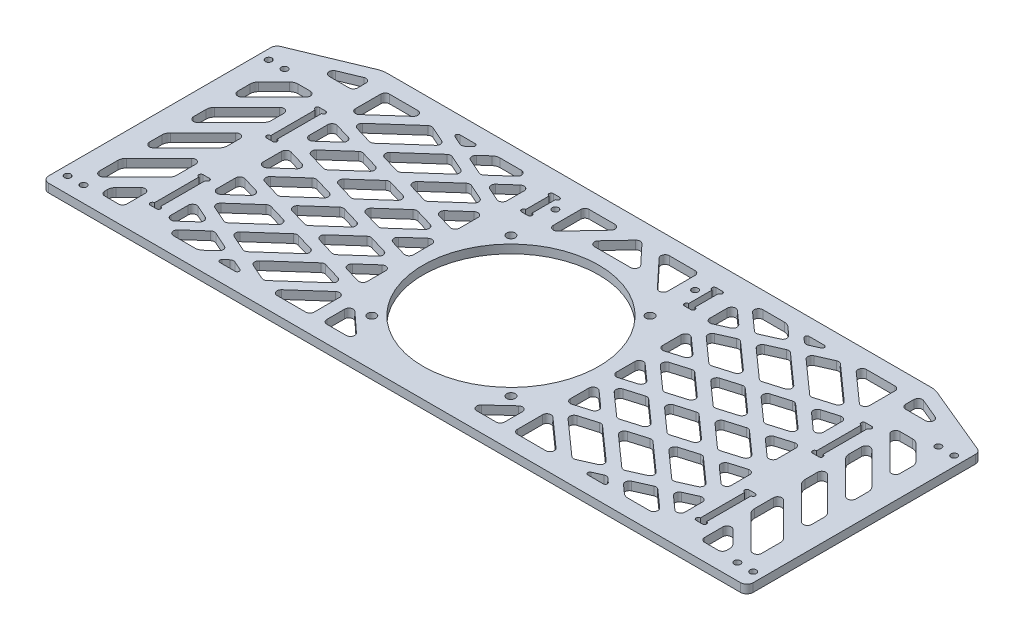
from build123d import *

# Parameters (mm, degrees)
SKETCH_1_R          = 41.5
SKETCH_1_R_2        = 1.5
SKETCH_1_W          = 3
SKETCH_1_H          = 25
EXTRUDE_1_DEPTH     = 4
SKETCH_2_R          = 2
SKETCH_2_W          = 3
SKETCH_2_H          = 15
CUT_EXTRUDE_1_DEPTH = 181.660593379
SKETCH_3_R          = 1
CUT_EXTRUDE_2_DEPTH = 181.660593379
SKETCH_12_W         = 73.5
SKETCH_12_H         = 109
CUT_EXTRUDE_8_DEPTH = 181.660593379
EXTRUDE_1_2_DEPTH   = 4
EXTRUDE_2_DEPTH     = 4
FILLET_1_R          = 3
FILLET_2_R          = 10
FILLET_3_R          = 4
FILLET_4_R          = 1
FILLET_5_R          = 2


with BuildPart() as part:
    # 草图1 → Extrude 1 (new body)
    with BuildSketch(Plane(origin=(0, 0, 0), x_dir=(1, 0, 0), z_dir=(0, 1, 0))):
        Polygon((-166.5, -55), (166.5, -55), (166.5, 55), (130.5, 70), (-130.5, 70), (-166.5, 55), align=None)
        with Locations(Location((0, 0, 0), (0, 0, 270))):
            Circle(SKETCH_1_R, mode=Mode.SUBTRACT)
        with Locations(Location((-33, 54, 0), (0, 0, 270))):
            Circle(SKETCH_1_R_2, mode=Mode.SUBTRACT)
        with Locations(Location((33, 54, 0), (0, 0, 270))):
            Circle(SKETCH_1_R_2, mode=Mode.SUBTRACT)
        with Locations(Location((-162, 47.5, 0), (0, 0, 270))):
            Circle(SKETCH_1_R_2, mode=Mode.SUBTRACT)
        with Locations(Location((-154.5, 47.5, 0), (0, 0, 270))):
            Circle(SKETCH_1_R_2, mode=Mode.SUBTRACT)
        with Locations(Location((-154.5, -47.5, 0), (0, 0, 270))):
            Circle(SKETCH_1_R_2, mode=Mode.SUBTRACT)
        with Locations(Location((-162, -47.5, 0), (0, 0, 270))):
            Circle(SKETCH_1_R_2, mode=Mode.SUBTRACT)
        with Locations(Location((154.5, -47.5, 0), (0, 0, 90))):
            Circle(SKETCH_1_R_2, mode=Mode.SUBTRACT)
        with Locations(Location((162, -47.5, 0), (0, 0, 90))):
            Circle(SKETCH_1_R_2, mode=Mode.SUBTRACT)
        with Locations(Location((154.5, 47.5, 0), (0, 0, 90))):
            Circle(SKETCH_1_R_2, mode=Mode.SUBTRACT)
        with Locations(Location((162, 47.5, 0), (0, 0, 90))):
            Circle(SKETCH_1_R_2, mode=Mode.SUBTRACT)
        with Locations((-129, 27.5)):
            Rectangle(SKETCH_1_W, SKETCH_1_H, mode=Mode.SUBTRACT)
        with Locations((129, -27.5)):
            Rectangle(SKETCH_1_W, SKETCH_1_H, mode=Mode.SUBTRACT)
        with Locations((129, 27.5)):
            Rectangle(SKETCH_1_W, SKETCH_1_H, mode=Mode.SUBTRACT)
        with Locations((-129, -27.5)):
            Rectangle(SKETCH_1_W, SKETCH_1_H, mode=Mode.SUBTRACT)
    extrude(amount=EXTRUDE_1_DEPTH)

    # 草图2 → 切除-拉伸1 (cut, through all)
    with BuildSketch(Plane(origin=(0, 4, 0), x_dir=(1, 0, 0), z_dir=(0, 1, 0))):
        with Locations(Location((-32.880465325, 32.880465325, 0), (0, 0, 270))):
            Circle(SKETCH_2_R)
        with Locations(Location((32.880465325, 32.880465325, 0), (0, 0, 90))):
            Circle(SKETCH_2_R)
        with Locations(Location((32.880465325, -32.880465325, 0), (0, 0, 270))):
            Circle(SKETCH_2_R)
        with Locations(Location((-32.880465325, -32.880465325, 0), (0, 0, 90))):
            Circle(SKETCH_2_R)
        with Locations((38.5, 52.5)):
            Rectangle(SKETCH_2_W, SKETCH_2_H)
        with Locations((-38.5, 52.5)):
            Rectangle(SKETCH_2_W, SKETCH_2_H)
    extrude(amount=-CUT_EXTRUDE_1_DEPTH, mode=Mode.SUBTRACT)

    # 草图3 → 切除-拉伸2 (cut, through all)
    with BuildSketch(Plane(origin=(0, 4, 0), x_dir=(1, 0, 0), z_dir=(0, 1, 0))):
        with Locations((-40, 59)):
            Circle(SKETCH_3_R)
        with Locations((-37, 59)):
            Circle(SKETCH_3_R)
        with Locations((-37, 46)):
            Circle(SKETCH_3_R)
        with Locations((-40, 46)):
            Circle(SKETCH_3_R)
        with Locations((40, 46)):
            Circle(SKETCH_3_R)
        with Locations((37, 46)):
            Circle(SKETCH_3_R)
        with Locations((37, 59)):
            Circle(SKETCH_3_R)
        with Locations((40, 59)):
            Circle(SKETCH_3_R)
        with Locations((-130.5, 39)):
            Circle(SKETCH_3_R)
        with Locations((-127.5, 39)):
            Circle(SKETCH_3_R)
        with Locations((-127.5, 16)):
            Circle(SKETCH_3_R)
        with Locations((-130.5, 16)):
            Circle(SKETCH_3_R)
        with Locations((-130.5, -16)):
            Circle(SKETCH_3_R)
        with Locations((-127.5, -16)):
            Circle(SKETCH_3_R)
        with Locations((-127.5, -39)):
            Circle(SKETCH_3_R)
        with Locations((-130.5, -39)):
            Circle(SKETCH_3_R)
        with Locations((130.5, -39)):
            Circle(SKETCH_3_R)
        with Locations((127.5, -39)):
            Circle(SKETCH_3_R)
        with Locations((127.5, -16)):
            Circle(SKETCH_3_R)
        with Locations((130.5, -16)):
            Circle(SKETCH_3_R)
        with Locations((130.5, 16)):
            Circle(SKETCH_3_R)
        with Locations((127.5, 16)):
            Circle(SKETCH_3_R)
        with Locations((127.5, 39)):
            Circle(SKETCH_3_R)
        with Locations((130.5, 39)):
            Circle(SKETCH_3_R)
    extrude(amount=-CUT_EXTRUDE_2_DEPTH, mode=Mode.SUBTRACT)

    # 草图12 → 切除-拉伸8 (cut, through all)
    with BuildSketch(Plane(origin=(0, 4, 0), x_dir=(1, 0, 0), z_dir=(0, 1, 0))):
        Polygon((-136.5, -7.64061146), (-136.5, -23.077665043), (-153.422334957, -40), (-156.5, -40), (-156.5, -27.64061146), align=None)
        Polygon((-136.5, 13.204058454), (-136.5, 0.844669914), (-156.5, -19.155330086), (-156.5, -6.795941546), align=None)
        Polygon((-156.5, 14.048728368), (-156.5, 1.689339828), (-136.5, 21.689339828), (-136.5, 34.048728368), align=None)
        Polygon((-136.5, -31.562946417), (-147, -42.062946417), (-147, -47), (-136.5, -47), align=None)
        Polygon((-146.85938854, 44.534009742), (-156.5, 34.893398282), (-156.5, 22.534009742), (-134.5, 44.534009742), align=None)
        Polygon((-129.5, 63.916666667), (-150.9, 55), (-129.5, 55), align=None)
        Polygon((-42, -32), (-25.74475114, -47), (-42, -47), align=None)
        with Locations((-84.75, 7.5)):
            Rectangle(SKETCH_12_W, SKETCH_12_H)
        Polygon((134.5, 44.534009742), (156.5, 22.534009742), (156.5, 34.893398282), (146.85938854, 44.534009742), align=None)
        Polygon((136.5, 34.048728368), (156.5, 14.048728368), (156.5, 1.689339828), (136.5, 21.689339828), align=None)
        Polygon((136.5, -23.077665043), (153.422334957, -40), (156.5, -40), (156.5, -27.64061146), (136.5, -7.64061146), align=None)
        Polygon((136.5, 0.844669914), (156.5, -19.155330086), (156.5, -6.795941546), (136.5, 13.204058454), align=None)
        with Locations((84.75, 7.5)):
            Rectangle(SKETCH_12_W, SKETCH_12_H)
        Polygon((42, -47), (42, -32), (25.74475114, -47), align=None)
        Polygon((129.5, 55), (129.5, 63.916666667), (150.9, 55), align=None)
        Polygon((147, -42.062946417), (147, -47), (136.5, -47), (136.5, -31.562946417), align=None)
        Polygon((-27, 62), (-27, 42), (-8.228752915, 62), align=None)
        Polygon((0, 62), (-13.139872959, 48), (13.139872959, 48), align=None)
        Polygon((8.228752915, 62), (27, 62), (27, 42), align=None)
    extrude(amount=-CUT_EXTRUDE_8_DEPTH, mode=Mode.SUBTRACT)

    # 草图13 → Extrude 1 2 (add)
    with BuildSketch(Plane(origin=(0, 4, 0), x_dir=(1, 0, 0), z_dir=(0, 1, 0))):
        Polygon((-71.920637458, 65.861908731), (-74.161855711, 63.867681877), (-126.518600414, 17.280864142), (-53.018600414, -4.519135858), (-98.661855711, -45.132318123), (-100.903073964, -47.126544976), (-97.579362542, -50.861908731), (-95.338144289, -48.867681877), (-42.981399586, -2.280864142), (-116.481399586, 19.519135858), (-70.838144289, 60.132318123), (-68.596926036, 62.126544976), align=None)
        Polygon((-49.661855711, 63.867681877), (-126.518600414, -4.519135858), (-48.710886968, -27.596797805), (-47.289113032, -22.803202195), (-116.481399586, -2.280864142), (-46.338144289, 60.132318123), align=None)
        Polygon((-119.838144289, -48.867681877), (-42.981399586, 19.519135858), (-120.789113032, 42.596797805), (-122.210886968, 37.803202195), (-53.018600414, 17.280864142), (-123.161855711, -45.132318123), align=None)
        Polygon((-71.483788884, -44.715855747), (-116.942663735, -24.491295099), (-43.442663735, 40.908704901), (-95.983788884, 64.284144253), (-98.016211116, 59.715855747), (-52.557336265, 39.491295099), (-126.057336265, -25.908704901), (-73.516211116, -49.284144253), align=None)
        Polygon((68.596926036, 62.126544976), (70.838144289, 60.132318123), (116.481399586, 19.519135858), (42.981399586, -2.280864142), (95.338144289, -48.867681877), (97.579362542, -50.861908731), (100.903073964, -47.126544976), (98.661855711, -45.132318123), (53.018600414, -4.519135858), (126.518600414, 17.280864142), (74.161855711, 63.867681877), (71.920637458, 65.861908731), align=None)
        Polygon((95.983788884, 64.284144253), (43.442663735, 40.908704901), (116.942663735, -24.491295099), (71.483788884, -44.715855747), (73.516211116, -49.284144253), (126.057336265, -25.908704901), (52.557336265, 39.491295099), (98.016211116, 59.715855747), align=None)
        Polygon((46.338144289, 60.132318123), (116.481399586, -2.280864142), (47.289113032, -22.803202195), (48.710886968, -27.596797805), (126.518600414, -4.519135858), (49.661855711, 63.867681877), align=None)
        Polygon((120.789113032, 42.596797805), (42.981399586, 19.519135858), (119.838144289, -48.867681877), (123.161855711, -45.132318123), (53.018600414, 17.280864142), (122.210886968, 37.803202195), align=None)
    extrude(amount=-EXTRUDE_1_2_DEPTH)

    # 草图14 → 拉伸-薄壁2 (add)
    with BuildSketch(Plane(origin=(0, 4, 0), x_dir=(1, 0, 0), z_dir=(0, 1, 0))):
        Polygon((95.338144289, 60.132318123), (119.838144289, 38.332318123), (123.161855711, 42.067681877), (98.661855711, 63.867681877), align=None)
        Polygon((74.161855711, -45.132318123), (49.661855711, -23.332318123), (46.338144289, -27.067681877), (70.838144289, -48.867681877), align=None)
        Polygon((-70.838144289, -48.867681877), (-46.338144289, -27.067681877), (-49.661855711, -23.332318123), (-74.161855711, -45.132318123), align=None)
        Polygon((-98.661855711, 63.867681877), (-123.161855711, 42.067681877), (-119.838144289, 38.332318123), (-95.338144289, 60.132318123), align=None)
    extrude(amount=-EXTRUDE_2_DEPTH)

    # 圆角1
    fillet_1_edges = [part.edges().sort_by_distance(p)[0] for p in [
        (166.5, 2, 55),
        (-166.5, 2, 55),
        (-166.5, 2, -55),
        (166.5, 2, -55),
    ]]
    fillet(fillet_1_edges, radius=FILLET_1_R)

    # 圆角2
    fillet_2_edges = [part.edges().sort_by_distance(p)[0] for p in [
        (-130.5, 2, -70),
        (130.5, 2, -70),
    ]]
    fillet(fillet_2_edges, radius=FILLET_2_R)

    # 圆角3
    fillet_3_edges = [part.edges().sort_by_distance(p)[0] for p in [
        (-136.5, 2, -21.689339828),
        (-156.5, 2, -14.048728368),
        (-156.5, 2, 6.795941546),
        (-136.5, 2, -0.844669914),
        (-156.5, 2, 27.64061146),
        (-136.5, 2, 23.077665043),
        (147, 2, 42.062946417),
        (136.5, 2, -21.689339828),
        (156.5, 2, -14.048728368),
        (146.85938854, 2, -44.534009742),
        (156.5, 2, -34.893398282),
        (136.5, 2, -0.844669914),
        (156.5, 2, 6.795941546),
        (136.5, 2, 23.077665043),
        (156.5, 2, 27.64061146),
        (-146.85938854, 2, -44.534009742),
        (-156.5, 2, -34.893398282),
        (-147, 2, 42.062946417),
        (-100.760855986, 2, 47),
        (-68.739144014, 2, -62),
        (100.760855986, 2, 47),
        (68.739144014, 2, -62),
    ]]
    fillet(fillet_3_edges, radius=FILLET_3_R)

    # 圆角4
    fillet_4_edges = [part.edges().sort_by_distance(p)[0] for p in [
        (-93.239144014, 2, 47),
        (-78.650296822, 2, 47),
        (-76.260855986, 2, -62),
        (-90.849703178, 2, -62),
        (93.239144014, 2, 47),
        (78.650296822, 2, 47),
        (76.260855986, 2, -62),
        (90.849703178, 2, -62),
    ]]
    fillet(fillet_4_edges, radius=FILLET_4_R)

    # 圆角5
    fillet_5_edges = [part.edges().sort_by_distance(p)[0] for p in [
        (64.790471717, 2, -50.406301105),
        (76.109330402, 2, -55.442038234),
        (63.87619495, 2, -44.527032228),
        (96.542861616, 2, -59.060365562),
        (100.760855986, 2, -62),
        (121.5, 2, -43.546394306),
        (116.481399586, 2, -41.319135858),
        (72.957138384, 2, 44.060365562),
        (68.739144014, 2, 47),
        (48, 2, 28.546394306),
        (53.018600414, 2, 26.319135858),
        (-53.018600414, 2, 26.319135858),
        (-48, 2, 28.546394306),
        (-72.957138384, 2, 44.060365562),
        (-68.739144014, 2, 47),
        (-116.481399586, 2, -41.319135858),
        (-121.5, 2, -43.546394306),
        (-96.542861616, 2, -59.060365562),
        (-100.760855986, 2, -62),
        (-136.5, 2, -34.048728368),
        (-156.5, 2, -1.689339828),
        (13.139872959, 2, -48),
        (-13.139872959, 2, -48),
        (0, 2, -62),
        (-136.5, 2, -13.204058454),
        (-156.5, 2, 19.155330086),
        (-153.422334957, 2, 40),
        (-156.5, 2, 40),
        (-136.5, 2, 7.64061146),
        (136.5, 2, 31.562946417),
        (147, 2, 47),
        (136.5, 2, 47),
        (150.9, 2, -55),
        (129.5, 2, -55),
        (129.5, 2, -63.916666667),
        (42, 2, 47),
        (25.74475114, 2, 47),
        (42, 2, 32),
        (121.5, 2, -62),
        (48, 2, 47),
        (136.5, 2, -34.048728368),
        (156.5, 2, -1.689339828),
        (134.5, 2, -44.534009742),
        (156.5, 2, -22.534009742),
        (136.5, 2, -13.204058454),
        (156.5, 2, 19.155330086),
        (136.5, 2, 7.64061146),
        (156.5, 2, 40),
        (153.422334957, 2, 40),
        (-129.5, 2, -63.916666667),
        (-129.5, 2, -55),
        (-150.9, 2, -55),
        (-42, 2, 47),
        (-42, 2, 32),
        (-25.74475114, 2, 47),
        (-121.5, 2, -62),
        (-48, 2, 47),
        (-27, 2, -62),
        (-8.228752915, 2, -62),
        (-27, 2, -42),
        (-134.5, 2, -44.534009742),
        (-156.5, 2, -22.534009742),
        (27, 2, -42),
        (8.228752915, 2, -62),
        (27, 2, -62),
        (-147, 2, 47),
        (-136.5, 2, 31.562946417),
        (-136.5, 2, 47),
        (-117.739144014, 2, 47),
        (-48, 2, 0.792354087),
        (-48, 2, 6.746394306),
        (-48, 2, 22.592354087),
        (-48, 2, -15.053605694),
        (-48, 2, -21.007645913),
        (-48, 2, -58.653605694),
        (-48, 2, -42.936254504),
        (-48, 2, -36.853605694),
        (-51.760855986, 2, -62),
        (-121.5, 2, 6.007645913),
        (-121.5, 2, 0.053605694),
        (-121.5, 2, -15.792354087),
        (-121.5, 2, -21.746394306),
        (-121.5, 2, -37.592354087),
        (-121.5, 2, 43.653605694),
        (-121.5, 2, 27.936254504),
        (-121.5, 2, 21.853605694),
        (-108.143600414, 2, 9.969135858),
        (-109.724002931, 2, 33.175371568),
        (-108.143600414, 2, -33.630864142),
        (-108.143600414, 2, -11.830864142),
        (-64.790471717, 2, -50.406301105),
        (-81.12380505, 2, -57.672967772),
        (-61.356399586, 2, -24.969135858),
        (-59.775997069, 2, -48.175371568),
        (-61.356399586, 2, 18.630864142),
        (-61.356399586, 2, -3.169135858),
        (-88.37619495, 2, 42.672967772),
        (-104.709528283, 2, 35.406301105),
        (-116.942663735, 2, 24.491295099),
        (-100.609330402, 2, 31.757961766),
        (-79.731399586, 2, -8.619135858),
        (-98.106399586, 2, 7.730864142),
        (-76.109330402, 2, -55.442038234),
        (-85.224002931, 2, -54.024628432),
        (-68.890669598, 2, -46.757961766),
        (-71.393600414, 2, -22.730864142),
        (-89.768600414, 2, -6.380864142),
        (-93.390669598, 2, 40.442038234),
        (-84.275997069, 2, 39.024628432),
        (-52.557336265, 2, -39.491295099),
        (-89.768600414, 2, -28.180864142),
        (-103.747683566, 2, -15.742333011),
        (-116.481399586, 2, -19.519135858),
        (-102.502316434, 2, -31.957666989),
        (-85.372683566, 2, -32.092333011),
        (-103.747683566, 2, -37.542333011),
        (-102.502316434, 2, -10.157666989),
        (-103.747683566, 2, 6.057666989),
        (-116.481399586, 2, 2.280864142),
        (-85.372683566, 2, -10.292333011),
        (-98.106399586, 2, -14.069135858),
        (-66.997683566, 2, -26.642333011),
        (-84.127316434, 2, -26.507666989),
        (-63.87619495, 2, -44.527032228),
        (-79.731399586, 2, -30.419135858),
        (-80.209528283, 2, -51.793698895),
        (-98.106399586, 2, -35.869135858),
        (-105.62380505, 2, 29.527032228),
        (-84.127316434, 2, 17.092333011),
        (-65.752316434, 2, -21.057666989),
        (-53.018600414, 2, -17.280864142),
        (-89.290471717, 2, 36.793698895),
        (-71.393600414, 2, 20.869135858),
        (-102.502316434, 2, 11.642333011),
        (-89.768600414, 2, 15.419135858),
        (-84.127316434, 2, -4.707666989),
        (-71.393600414, 2, -0.930864142),
        (-85.372683566, 2, 11.507666989),
        (-65.752316434, 2, 0.742333011),
        (-66.997683566, 2, -4.842333011),
        (-65.752316434, 2, 22.542333011),
        (-53.018600414, 2, 4.519135858),
        (-79.731399586, 2, 13.180864142),
        (-66.997683566, 2, 16.957666989),
        (48, 2, -42.936254504),
        (48, 2, -58.653605694),
        (48, 2, -36.853605694),
        (48, 2, 0.792354087),
        (48, 2, 6.746394306),
        (48, 2, 22.592354087),
        (48, 2, -21.007645913),
        (48, 2, -15.053605694),
        (117.739144014, 2, 47),
        (121.5, 2, 27.936254504),
        (121.5, 2, -21.746394306),
        (121.5, 2, -15.792354087),
        (121.5, 2, 0.053605694),
        (121.5, 2, 6.007645913),
        (121.5, 2, 21.853605694),
        (121.5, 2, -37.592354087),
        (121.5, 2, 43.653605694),
        (51.760855986, 2, -62),
        (81.12380505, 2, -57.672967772),
        (109.724002931, 2, 33.175371568),
        (108.143600414, 2, 9.969135858),
        (108.143600414, 2, -11.830864142),
        (108.143600414, 2, -33.630864142),
        (88.37619495, 2, 42.672967772),
        (61.356399586, 2, -24.969135858),
        (61.356399586, 2, 18.630864142),
        (61.356399586, 2, -3.169135858),
        (59.775997069, 2, -48.175371568),
        (85.372683566, 2, -32.092333011),
        (103.747683566, 2, -37.542333011),
        (65.752316434, 2, 0.742333011),
        (85.372683566, 2, 11.507666989),
        (66.997683566, 2, -4.842333011),
        (53.018600414, 2, -17.280864142),
        (84.127316434, 2, -26.507666989),
        (71.393600414, 2, -22.730864142),
        (102.502316434, 2, -31.957666989),
        (84.127316434, 2, 17.092333011),
        (100.609330402, 2, 31.757961766),
        (103.747683566, 2, 6.057666989),
        (89.768600414, 2, -6.380864142),
        (102.502316434, 2, -10.157666989),
        (116.481399586, 2, 2.280864142),
        (102.502316434, 2, 11.642333011),
        (116.942663735, 2, 24.491295099),
        (98.106399586, 2, -14.069135858),
        (85.372683566, 2, -10.292333011),
        (116.481399586, 2, -19.519135858),
        (65.752316434, 2, -21.057666989),
        (79.731399586, 2, -8.619135858),
        (89.768600414, 2, -28.180864142),
        (103.747683566, 2, -15.742333011),
        (71.393600414, 2, -0.930864142),
        (84.127316434, 2, -4.707666989),
        (105.62380505, 2, 29.527032228),
        (89.768600414, 2, 15.419135858),
        (98.106399586, 2, 7.730864142),
        (65.752316434, 2, 22.542333011),
        (84.275997069, 2, 39.024628432),
        (71.393600414, 2, 20.869135858),
        (89.290471717, 2, 36.793698895),
        (53.018600414, 2, 4.519135858),
        (104.709528283, 2, 35.406301105),
        (93.390669598, 2, 40.442038234),
        (79.731399586, 2, 13.180864142),
        (66.997683566, 2, 16.957666989),
        (79.731399586, 2, -30.419135858),
        (68.890669598, 2, -46.757961766),
        (98.106399586, 2, -35.869135858),
        (80.209528283, 2, -51.793698895),
        (66.997683566, 2, -26.642333011),
        (52.557336265, 2, -39.491295099),
        (85.224002931, 2, -54.024628432),
    ]]
    fillet(fillet_5_edges, radius=FILLET_5_R)


solid = part.part
